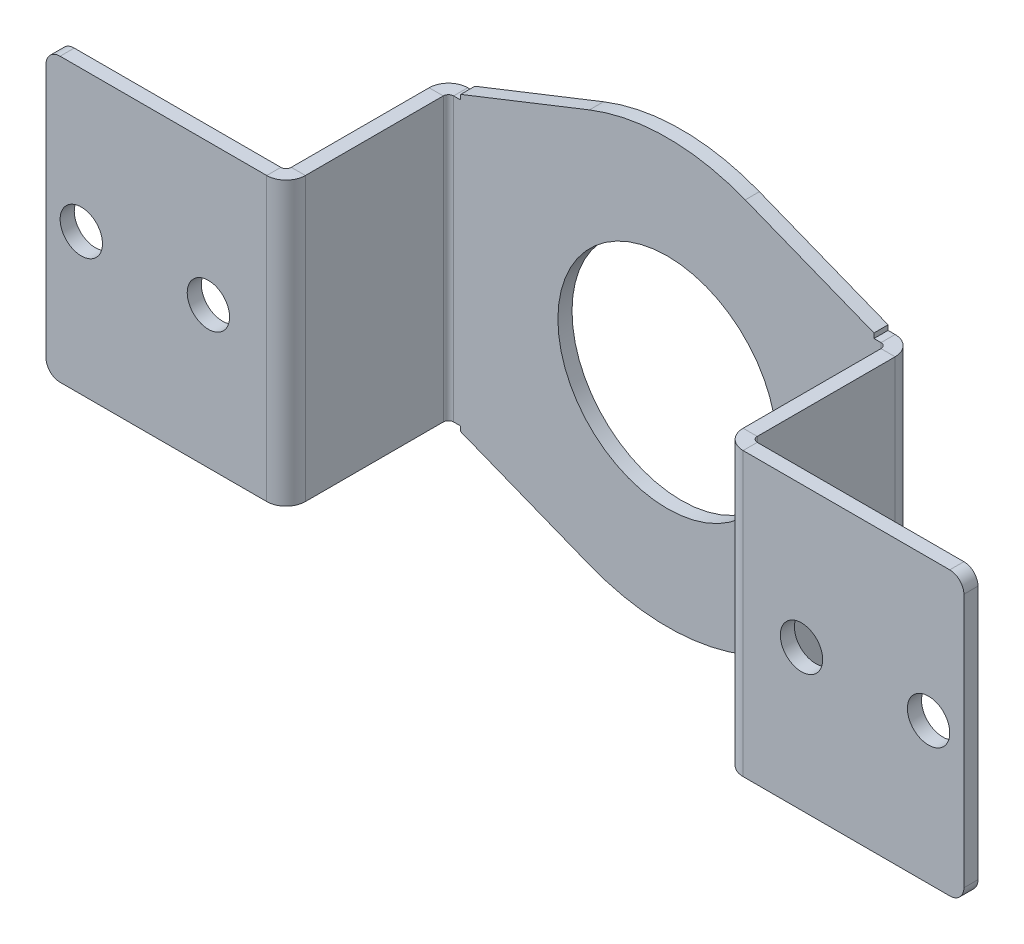
from build123d import *

# Parameters (mm, degrees)
SKETCH1_R                       = 15.5
BASE_FLANGE1_DEPTH              = 2
EDGE_FLANGE1_STRIP_W            = 9.4732
EDGE_FLANGE1_STRIP_H            = 2
EDGE_FLANGE1_STRIP_CUT_DEPTH    = 40
EDGE_FLANGE1_RELIEF_W           = 10.4732
EDGE_FLANGE1_RELIEF_H           = 1
EDGE_FLANGE1_RELIEF_CUT_DEPTH   = 2
EDGE_FLANGE1_STRIP_2_W          = 9.4732
EDGE_FLANGE1_STRIP_2_H          = 2
EDGE_FLANGE1_STRIP_CUT_2_DEPTH  = 40
EDGE_FLANGE1_RELIEF_2_W         = 10.4732
EDGE_FLANGE1_RELIEF_2_H         = 1
EDGE_FLANGE1_RELIEF_CUT_2_DEPTH = 2
EDGE_FLANGE1_DEPTH              = 40
EDGE_FLANGE1_BEND_DEPTH         = 40
EDGE_FLANGE2_STRIP_W            = 9.4732
EDGE_FLANGE2_STRIP_H            = 2
EDGE_FLANGE2_STRIP_CUT_DEPTH    = 40
EDGE_FLANGE2_STRIP_2_W          = 9.4732
EDGE_FLANGE2_STRIP_2_H          = 2
EDGE_FLANGE2_STRIP_CUT_2_DEPTH  = 40
EDGE_FLANGE2_DEPTH              = 40
EDGE_FLANGE2_BEND_DEPTH         = 40
SKETCH17_R                      = 3
CUT_EXTRUDE1_DEPTH              = 10
FILLET1_R                       = 2


# Sheet-metal steps are written as plain solids
with BuildPart() as part:
    # Sketch1 → Base-Flange1 (new body)
    with BuildSketch(Plane.XY):
        with BuildLine():
            Line((-31, 20), (-11.034132012, 27.897095382))
            ThreePointArc((-11.034132012, 27.897095382), (0, 30), (11.034132012, 27.897095382))
            Line((11.034132012, 27.897095382), (31, 20))
            Line((31, 20), (31, -20))
            Line((31, -20), (11.034132012, -27.897095382))
            ThreePointArc((11.034132012, -27.897095382), (0, -30), (-11.034132012, -27.897095382))
            Line((-11.034132012, -27.897095382), (-31, -20))
            Line((-31, -20), (-31, 20))
        make_face()
        Circle(SKETCH1_R, mode=Mode.SUBTRACT)
    extrude(amount=-BASE_FLANGE1_DEPTH)

    # Edge-Flange1 strip (across the edge) → Edge-Flange1 strip cut (cut)
    with BuildSketch(Plane(origin=(-31, 20, 0), x_dir=(1, 0, 0), z_dir=(0, -1, 0))):
        with Locations((-4, -1)):
            Rectangle(EDGE_FLANGE1_STRIP_W, EDGE_FLANGE1_STRIP_H)
    extrude(amount=EDGE_FLANGE1_STRIP_CUT_DEPTH, mode=Mode.SUBTRACT)

    # Edge-Flange1 relief (on the sheet) → Edge-Flange1 relief cut (cut)
    with BuildSketch(Plane(origin=(-30.2634, 20, 0), x_dir=(1, 0, 0), z_dir=(0, 0, 1))):
        with Locations((-4.2366, 0.5)):
            Rectangle(EDGE_FLANGE1_RELIEF_W, EDGE_FLANGE1_RELIEF_H)
        with Locations((-4.2366, -40.5)):
            Rectangle(EDGE_FLANGE1_RELIEF_W, EDGE_FLANGE1_RELIEF_H)
    extrude(amount=-EDGE_FLANGE1_RELIEF_CUT_DEPTH, mode=Mode.SUBTRACT)

    # Edge-Flange1 strip 2 (across the edge) → Edge-Flange1 strip cut 2 (cut)
    with BuildSketch(Plane(origin=(31, -20, 0), x_dir=(-1, 0, 0), z_dir=(0, 1, 0))):
        with Locations((-4, -1)):
            Rectangle(EDGE_FLANGE1_STRIP_2_W, EDGE_FLANGE1_STRIP_2_H)
    extrude(amount=EDGE_FLANGE1_STRIP_CUT_2_DEPTH, mode=Mode.SUBTRACT)

    # Edge-Flange1 relief 2 (on the sheet) → Edge-Flange1 relief cut 2 (cut)
    with BuildSketch(Plane(origin=(30.2634, -20, 0), x_dir=(-1, 0, 0), z_dir=(0, 0, 1))):
        with Locations((-4.2366, 0.5)):
            Rectangle(EDGE_FLANGE1_RELIEF_2_W, EDGE_FLANGE1_RELIEF_2_H)
        with Locations((-4.2366, -40.5)):
            Rectangle(EDGE_FLANGE1_RELIEF_2_W, EDGE_FLANGE1_RELIEF_2_H)
    extrude(amount=-EDGE_FLANGE1_RELIEF_CUT_2_DEPTH, mode=Mode.SUBTRACT)

    # Edge-Flange1 section (across the edge) → Edge-Flange1 (add)
    with BuildSketch(Plane(origin=(-31, 20, 0), x_dir=(1, 0, 0), z_dir=(0, -1, 0))):
        with BuildLine():
            Line((-2, 0.7366), (-2, 21))
            Line((-2, 21), (0, 21))
            Line((0, 21), (0, 0.7366))
            ThreePointArc((0, 0.7366), (0.215745145, 0.215745145), (0.7366, 0))
            Line((0.7366, 0), (0.7366, -2))
            ThreePointArc((0.7366, -2), (-1.198468417, -1.198468417), (-2, 0.7366))
        make_face()
    extrude(amount=EDGE_FLANGE1_DEPTH)

    # Edge-Flange1 section 2 (across the edge) → Edge-Flange1 bend (add)
    with BuildSketch(Plane(origin=(31, -20, 0), x_dir=(-1, 0, 0), z_dir=(0, 1, 0))):
        with BuildLine():
            Line((-2, 0.7366), (-2, 21))
            Line((-2, 21), (0, 21))
            Line((0, 21), (0, 0.7366))
            ThreePointArc((0, 0.7366), (0.215745145, 0.215745145), (0.7366, 0))
            Line((0.7366, 0), (0.7366, -2))
            ThreePointArc((0.7366, -2), (-1.198468417, -1.198468417), (-2, 0.7366))
        make_face()
    extrude(amount=EDGE_FLANGE1_BEND_DEPTH)

    # Edge-Flange2 strip (across the edge) → Edge-Flange2 strip cut (cut)
    with BuildSketch(Plane(origin=(-33, -20, 21), x_dir=(0, 0, -1), z_dir=(0, 1, 0))):
        with Locations((-4, -1)):
            Rectangle(EDGE_FLANGE2_STRIP_W, EDGE_FLANGE2_STRIP_H)
    extrude(amount=EDGE_FLANGE2_STRIP_CUT_DEPTH, mode=Mode.SUBTRACT)

    # Edge-Flange2 strip 2 (across the edge) → Edge-Flange2 strip cut 2 (cut)
    with BuildSketch(Plane(origin=(33, 20, 21), x_dir=(0, 0, -1), z_dir=(0, -1, 0))):
        with Locations((-4, -1)):
            Rectangle(EDGE_FLANGE2_STRIP_2_W, EDGE_FLANGE2_STRIP_2_H)
    extrude(amount=EDGE_FLANGE2_STRIP_CUT_2_DEPTH, mode=Mode.SUBTRACT)

    # Edge-Flange2 section (across the edge) → Edge-Flange2 (add)
    with BuildSketch(Plane(origin=(-33, -20, 21), x_dir=(0, 0, -1), z_dir=(0, 1, 0))):
        with BuildLine():
            Line((-2, 0.7366), (-2, 32))
            Line((-2, 32), (0, 32))
            Line((0, 32), (0, 0.7366))
            ThreePointArc((0, 0.7366), (0.215745145, 0.215745145), (0.7366, 0))
            Line((0.7366, 0), (0.7366, -2))
            ThreePointArc((0.7366, -2), (-1.198468417, -1.198468417), (-2, 0.7366))
        make_face()
    extrude(amount=EDGE_FLANGE2_DEPTH)

    # Edge-Flange2 section 2 (across the edge) → Edge-Flange2 bend (add)
    with BuildSketch(Plane(origin=(33, 20, 21), x_dir=(0, 0, -1), z_dir=(0, -1, 0))):
        with BuildLine():
            Line((-2, 0.7366), (-2, 32))
            Line((-2, 32), (0, 32))
            Line((0, 32), (0, 0.7366))
            ThreePointArc((0, 0.7366), (0.215745145, 0.215745145), (0.7366, 0))
            Line((0.7366, 0), (0.7366, -2))
            ThreePointArc((0.7366, -2), (-1.198468417, -1.198468417), (-2, 0.7366))
        make_face()
    extrude(amount=EDGE_FLANGE2_BEND_DEPTH)

    # Sketch17 → Cut-Extrude1 (cut)
    with BuildSketch(Plane(origin=(0, 0, 21), x_dir=(-1, 0, 0), z_dir=(0, 0, -1))):
        with Locations((60, 0)):
            Circle(SKETCH17_R)
        with Locations((42, 0)):
            Circle(SKETCH17_R)
        with Locations((-60, 0)):
            Circle(SKETCH17_R)
        with Locations((-42, 0)):
            Circle(SKETCH17_R)
    extrude(amount=-CUT_EXTRUDE1_DEPTH, mode=Mode.SUBTRACT)

    # Fillet1
    fillet1_edges = [part.edges().sort_by_distance(p)[0] for p in [
        (-65, -20, 22),
        (-65, 20, 22),
        (65, 20, 22),
        (65, -20, 22),
    ]]
    fillet(fillet1_edges, radius=FILLET1_R)


solid = part.part
